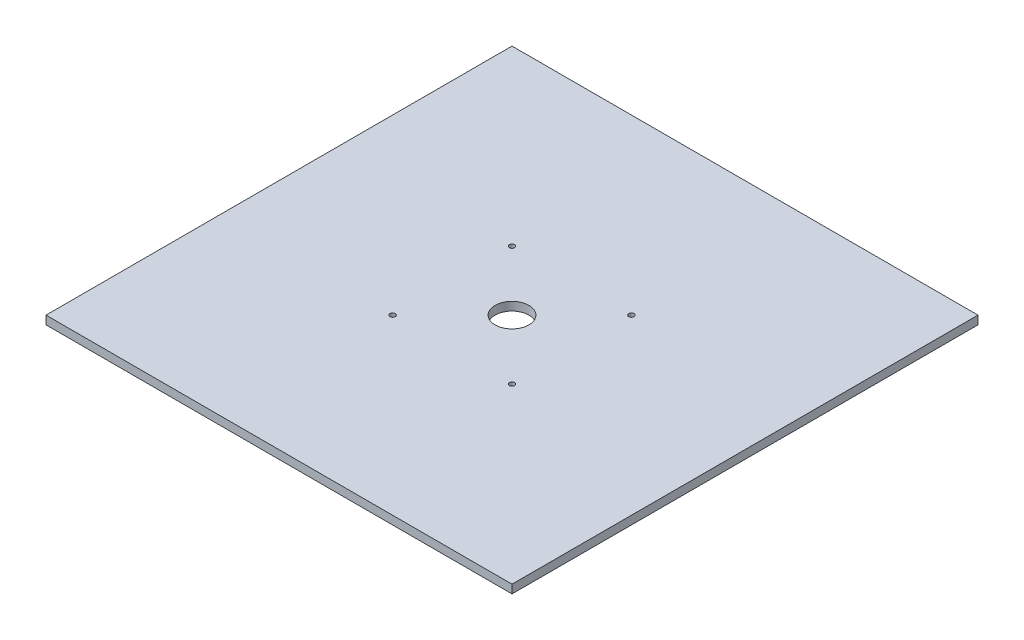
from build123d import *

# Parameters (mm, degrees)
SKETCH1_W               = 350
SKETCH1_H               = 350
BOSS_EXTRUDE1_DEPTH     = 6.35
CUT_EXTRUDE1_DEPTH      = 248.568823764
CUT_EXTRUDE1_DEPTH_BACK = 248.568823764
SKETCH2_R               = 1.984375
SKETCH2_R_2             = 12.7


with BuildPart() as part:
    # Sketch1 → Boss-Extrude1 (new body)
    with BuildSketch(Plane(origin=(0, 0, 0), x_dir=(1, 0, 0), z_dir=(0, 1, 0))):
        Rectangle(SKETCH1_W, SKETCH1_H)
    extrude(amount=BOSS_EXTRUDE1_DEPTH)

    # Sketch2 → Cut-Extrude1 (cut, two sides: drawn at the far end of the back side and taken through both)
    with BuildSketch(Plane(origin=(0, 6.35, 0), x_dir=(1, 0, 0), z_dir=(0, 1, 0)).offset(-CUT_EXTRUDE1_DEPTH_BACK)):
        with Locations((-44.8437, 44.8437)):
            Circle(SKETCH2_R)
        with Locations((44.8437, 44.8437)):
            Circle(SKETCH2_R)
        with Locations((-44.8437, -44.8437)):
            Circle(SKETCH2_R)
        with Locations((44.8437, -44.8437)):
            Circle(SKETCH2_R)
        Circle(SKETCH2_R_2)
    extrude(amount=CUT_EXTRUDE1_DEPTH + CUT_EXTRUDE1_DEPTH_BACK, mode=Mode.SUBTRACT)


solid = part.part
